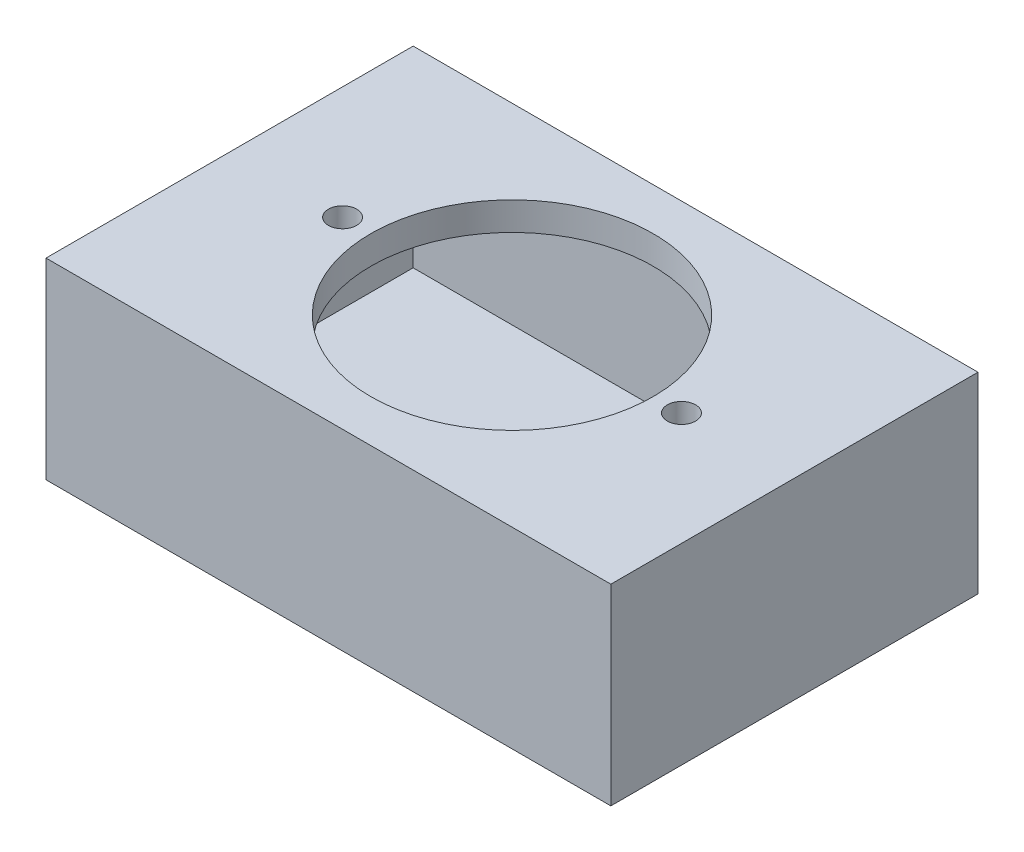
from build123d import *

# Parameters (mm, degrees)
SKETCH1_W           = 200
SKETCH1_H           = 130
BOSS_EXTRUDE1_DEPTH = 58
SHELL1_T            = -10
SKETCH2_R           = 1.5
CUT_EXTRUDE1_DEPTH  = 129.565158577
SKETCH3_W           = 200
SKETCH3_H           = 130
BOSS_EXTRUDE2_DEPTH = 10
CUT_EXTRUDE2_REACH  = 139.292
SKETCH4_R           = 50
SKETCH4_R_2         = 5


with BuildPart() as part:
    # Sketch1 → Boss-Extrude1 (new body)
    with BuildSketch(Plane(origin=(0, 0, 0), x_dir=(1, 0, 0), z_dir=(0, 1, 0))):
        Rectangle(SKETCH1_W, SKETCH1_H)
    extrude(amount=BOSS_EXTRUDE1_DEPTH)

    # Shell1
    shell1_openings = [part.faces().sort_by_distance(p)[0] for p in [
        (0, 58, 0),
    ]]
    offset(amount=SHELL1_T, openings=shell1_openings, kind=Kind.INTERSECTION)

    # Sketch2 → Cut-Extrude1 (cut, through all)
    with BuildSketch(Plane(origin=(0, 10, 0), x_dir=(1, 0, 0), z_dir=(0, 1, 0))):
        with Locations((-15.5, 15.5)):
            Circle(SKETCH2_R)
        with Locations((15.5, 15.5)):
            Circle(SKETCH2_R)
        with Locations((-15.5, -15.5)):
            Circle(SKETCH2_R)
        with Locations((15.5, -15.5)):
            Circle(SKETCH2_R)
    extrude(amount=-CUT_EXTRUDE1_DEPTH, mode=Mode.SUBTRACT)

    # Sketch3 → Boss-Extrude2 (add)
    with BuildSketch(Plane(origin=(0, 58, 0), x_dir=(1, 0, 0), z_dir=(0, 1, 0))):
        Rectangle(SKETCH3_W, SKETCH3_H)
    extrude(amount=BOSS_EXTRUDE2_DEPTH)

    # Sketch4 → Cut-Extrude2 (cut, up to next)
    with BuildSketch(Plane(origin=(0, 68, 0), x_dir=(1, 0, 0), z_dir=(0, 1, 0)), mode=Mode.PRIVATE) as cut_extrude2_sk1:
        Circle(SKETCH4_R)
    cut_extrude2_tool1 = extrude(cut_extrude2_sk1.sketch, amount=-CUT_EXTRUDE2_REACH, mode=Mode.PRIVATE) & part.part
    # Sketch4 → Cut-Extrude2 (cut, up to next)
    with BuildSketch(Plane(origin=(0, 68, 0), x_dir=(1, 0, 0), z_dir=(0, 1, 0)), mode=Mode.PRIVATE) as cut_extrude2_sk2:
        with Locations((-60, 0)):
            Circle(SKETCH4_R_2)
    cut_extrude2_tool2 = extrude(cut_extrude2_sk2.sketch, amount=-CUT_EXTRUDE2_REACH, mode=Mode.PRIVATE) & part.part
    # Sketch4 → Cut-Extrude2 (cut, up to next)
    with BuildSketch(Plane(origin=(0, 68, 0), x_dir=(1, 0, 0), z_dir=(0, 1, 0)), mode=Mode.PRIVATE) as cut_extrude2_sk3:
        with Locations((60, 0)):
            Circle(SKETCH4_R_2)
    cut_extrude2_tool3 = extrude(cut_extrude2_sk3.sketch, amount=-CUT_EXTRUDE2_REACH, mode=Mode.PRIVATE) & part.part
    add(cut_extrude2_tool1.solids().sort_by_distance((0, 68, 0))[0], mode=Mode.SUBTRACT)
    add(cut_extrude2_tool2.solids().sort_by_distance((-60, 68, 0))[0], mode=Mode.SUBTRACT)
    add(cut_extrude2_tool3.solids().sort_by_distance((60, 68, 0))[0], mode=Mode.SUBTRACT)


solid = part.part
